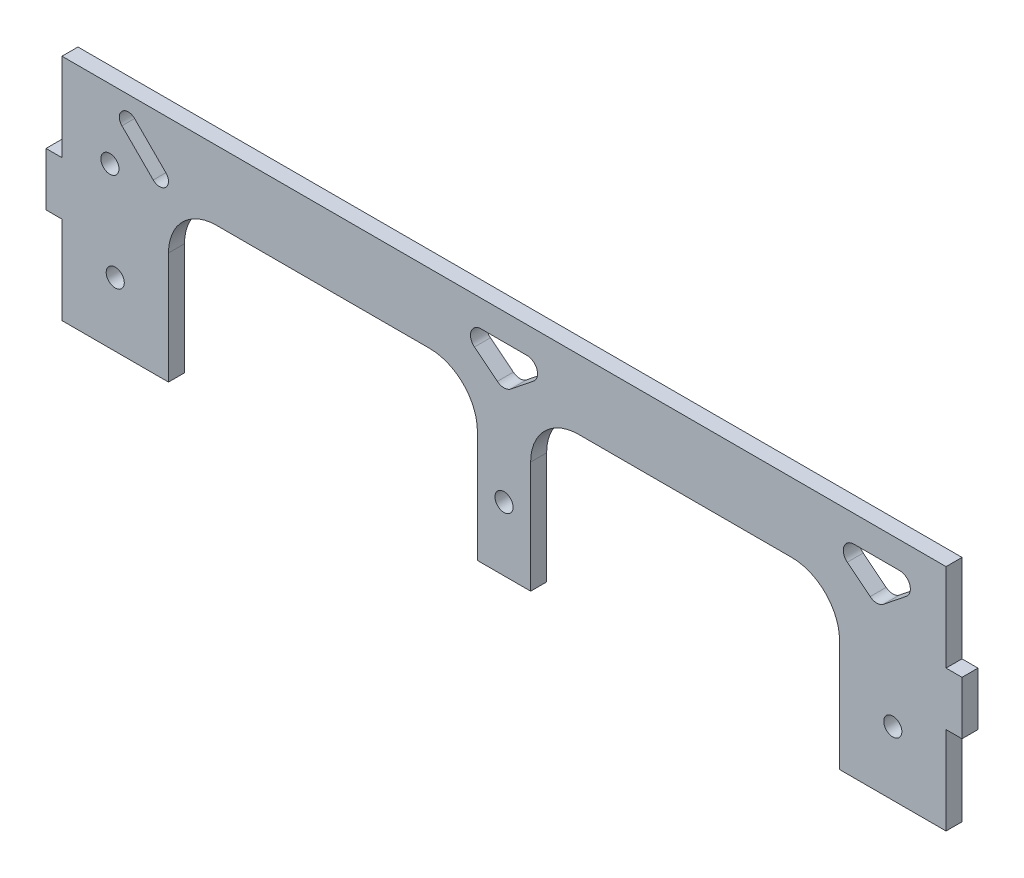
from build123d import *

# Parameters (mm, degrees)
BOSS_EXTRUDE1_DEPTH = 3
FILLET1_R           = 9
SKETCH2_R           = 1.7
CUT_EXTRUDE1_DEPTH  = 175.410435468
SKETCH3_R           = 1.7
CUT_EXTRUDE2_DEPTH  = 175.410435468
CUT_EXTRUDE3_DEPTH  = 175.410435468
FILLET3_R           = 2
CUT_EXTRUDE4_DEPTH  = 175.410435468


with BuildPart() as part:
    # Sketch1 → Boss-Extrude1 (new body)
    with BuildSketch(Plane.XY):
        Polygon((0, 0), (0, 16.5), (-3, 16.5), (-3, 26.5), (0, 26.5), (0, 43), (166, 43), (166, 26.5), (169, 26.5), (169, 16.5), (166, 16.5), (166, 0), (146, 0), (146, 30), (88, 30), (88, 0), (78, 0), (78, 30), (20, 30), (20, 0), align=None)
    extrude(amount=BOSS_EXTRUDE1_DEPTH)

    # Fillet1
    fillet1_edges = [part.edges().sort_by_distance(p)[0] for p in [
        (146, 30, 1.5),
        (88, 30, 1.5),
        (78, 30, 1.5),
        (20, 30, 1.5),
    ]]
    fillet(fillet1_edges, radius=FILLET1_R)

    # Sketch2 → Cut-Extrude1 (cut, through all)
    with BuildSketch(Plane.XY.offset(3)):
        with Locations((10, 12)):
            Circle(SKETCH2_R)
        with Locations((83, 12)):
            Circle(SKETCH2_R)
        with Locations((156, 12)):
            Circle(SKETCH2_R)
    extrude(amount=-CUT_EXTRUDE1_DEPTH, mode=Mode.SUBTRACT)

    # Sketch3 → Cut-Extrude2 (cut, through all)
    with BuildSketch(Plane.XY.offset(3)):
        with Locations((9, 30)):
            Circle(SKETCH3_R)
    extrude(amount=-CUT_EXTRUDE2_DEPTH, mode=Mode.SUBTRACT)

    # Sketch4 → Cut-Extrude3 (cut, through all)
    with BuildSketch(Plane.XY.offset(3)):
        Polygon((73, 38), (83, 30), (93, 38), align=None)
        Polygon((143, 38), (153, 30), (163, 38), align=None)
    extrude(amount=-CUT_EXTRUDE3_DEPTH, mode=Mode.SUBTRACT)

    # Fillet3
    fillet3_edges = [part.edges().sort_by_distance(p)[0] for p in [
        (83, 30, 1.5),
        (93, 38, 1.5),
        (73, 38, 1.5),
        (153, 30, 1.5),
        (163, 38, 1.5),
        (143, 38, 1.5),
    ]]
    fillet(fillet3_edges, radius=FILLET3_R)

    # Sketch5 → Cut-Extrude4 (cut, through all)
    with BuildSketch(Plane.XY.offset(3)):
        with BuildLine():
            Line((13.631225387, 39.680056334), (19.506697607, 33.804584113))
            ThreePointArc((19.506697607, 33.804584113), (19.506697607, 31.436856502), (17.138969996, 31.436856502))
            Line((17.138969996, 31.436856502), (11.263497776, 37.312328722))
            ThreePointArc((11.263497776, 37.312328722), (11.263497776, 39.680056334), (13.631225387, 39.680056334))
        make_face()
    extrude(amount=-CUT_EXTRUDE4_DEPTH, mode=Mode.SUBTRACT)


solid = part.part
